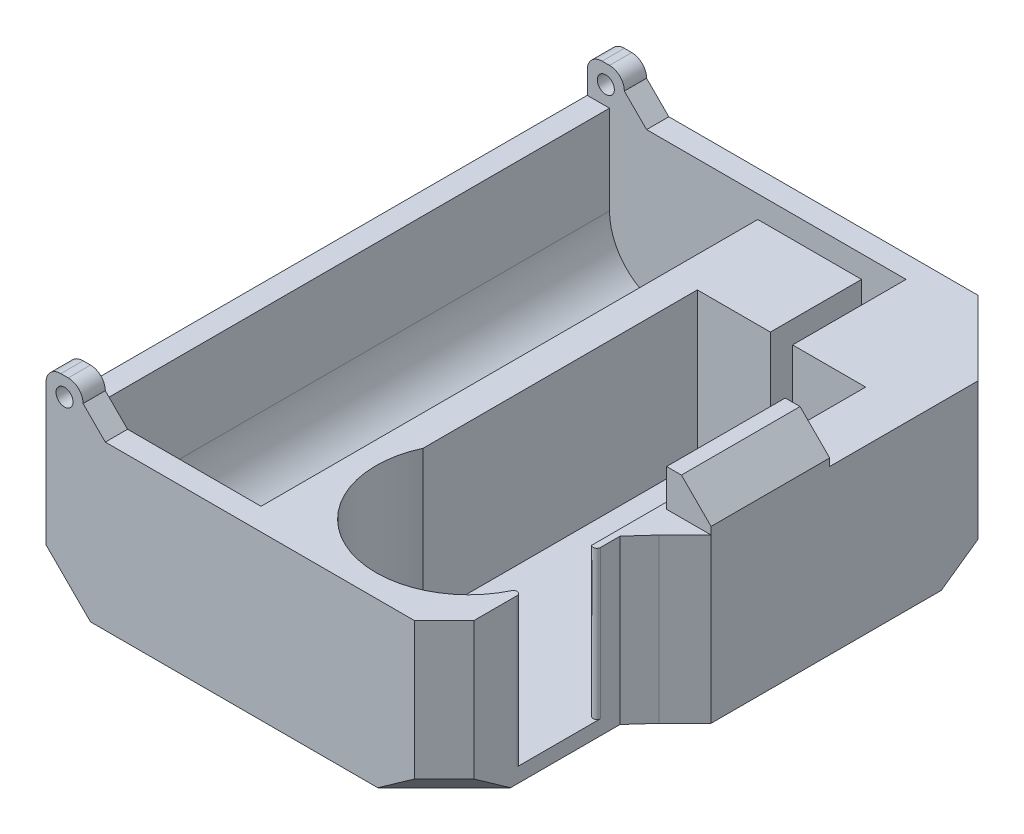
from build123d import *

# Parameters (mm, degrees)
BOSS_EXTRUDE1_START       = 10
SKETCH1_R                 = 1.15
BOSS_EXTRUDE1_DEPTH       = 76
SKETCH2_W                 = 6
SKETCH2_H                 = 16.4
CUT_EXTRUDE1_DEPTH        = 76
BOSS_EXTRUDE2_START       = -47.8
BOSS_EXTRUDE2_DEPTH       = 37.686187853
BOSS_EXTRUDE2_START_2     = -51.8
BOSS_EXTRUDE2_2_OUTLINE_W = 9.85
BOSS_EXTRUDE2_2_OUTLINE_H = 20
BOSS_EXTRUDE2_2_DEPTH     = 12.300000091
BOSS_EXTRUDE2_START_3     = -57.8
BOSS_EXTRUDE2_3_OUTLINE_R = 1.15
BOSS_EXTRUDE2_3_DEPTH     = 3
BOSS_EXTRUDE2_START_4     = 15.2
BOSS_EXTRUDE2_4_OUTLINE_R = 1.15
BOSS_EXTRUDE2_4_DEPTH     = 3
BOSS_EXTRUDE2_START_5     = -27.8
BOSS_EXTRUDE2_5_OUTLINE_W = 6
BOSS_EXTRUDE2_5_OUTLINE_H = 5
BOSS_EXTRUDE2_5_DEPTH     = 16
BOSS_EXTRUDE2_START_6     = -11.8
BOSS_EXTRUDE2_6_DEPTH     = 1.69328026
BOSS_EXTRUDE2_START_7     = -2
BOSS_EXTRUDE2_7_OUTLINE_W = 3
BOSS_EXTRUDE2_7_OUTLINE_H = 10
BOSS_EXTRUDE2_7_DEPTH     = 22
BOSS_EXTRUDE2_8_DEPTH     = 2
BOSS_EXTRUDE2_START_8     = -39.951533137
BOSS_EXTRUDE2_9_OUTLINE_W = 10
BOSS_EXTRUDE2_9_OUTLINE_H = 25.30671974
BOSS_EXTRUDE2_9_DEPTH     = 14.849242405
CHAMFER1_SIZE             = 10
CHAMFER2_SIZE             = 4
CHAMFER3_SIZE             = 4
SKETCH4_W                 = 5
SKETCH4_H                 = 3.2
CUT_EXTRUDE2_DEPTH        = 17
SKETCH5_W                 = 92.220715814
SKETCH5_H                 = 108.753281114
CUT_EXTRUDE3_DEPTH        = 17
BOSS_EXTRUDE3_DEPTH       = 3
BOSS_EXTRUDE4_DEPTH       = 3
CUT_EXTRUDE5_DEPTH        = 26
FILLET1_R                 = 0.5
FILLET2_R                 = 8
CHAMFER4_SIZE             = 6
CHAMFER6_SIZE             = 3.5
BOSS_EXTRUDE6_DEPTH       = 20
CUT_EXTRUDE10_DEPTH       = 34
SKETCH14_W                = 6.88450438
SKETCH14_H                = 12.178080633
CUT_EXTRUDE11_DEPTH       = 5
FILLET3_R                 = 0.5


with BuildPart() as part:
    # Sketch1 → Boss-Extrude1 (new body)
    with BuildSketch(Plane(origin=(0, 0, -57.8), x_dir=(-1, 0, 0), z_dir=(0, 0, -1)).offset(BOSS_EXTRUDE1_START)):
        with BuildLine():
            Line((39, 25), (-18.2, 25))
            Line((-18.2, 25), (-18.2, 20))
            Line((-18.2, 20), (39, 20))
            ThreePointArc((39, 20), (41.5, 22.5), (39, 25))
        make_face()
        with Locations((39, 22.5)):
            Circle(SKETCH1_R, mode=Mode.SUBTRACT)
    extrude(amount=BOSS_EXTRUDE1_DEPTH)

    # Sketch2 → Cut-Extrude1 (cut)
    with BuildSketch(Plane(origin=(0, 25, 0), x_dir=(1, 0, 0), z_dir=(0, 1, 0))):
        with Locations((15.2, 105.8)):
            Rectangle(SKETCH2_W, SKETCH2_H)
    extrude(amount=-CUT_EXTRUDE1_DEPTH, mode=Mode.SUBTRACT)

    # Chamfer1
    chamfer1_edges = [part.edges().sort_by_distance(p)[0] for p in [
        (18.2, 22.5, -143.8),
        (18.2, 22.5, -67.8),
    ]]
    chamfer(chamfer1_edges, length=CHAMFER1_SIZE)

    # Chamfer2
    chamfer2_edges = [part.edges().sort_by_distance(p)[0] for p in [
        (18.2, 25, -87.7),
        (18.2, 25, -123.9),
    ]]
    chamfer(chamfer2_edges, length=CHAMFER2_SIZE)

    # Sketch4 → Cut-Extrude2 (cut)
    with BuildSketch(Plane(origin=(0, 25, 0), x_dir=(1, 0, 0), z_dir=(0, 1, 0))):
        with Locations((-39, 69.4)):
            Rectangle(SKETCH4_W, SKETCH4_H)
        with Locations((-39, 142.2)):
            Rectangle(SKETCH4_W, SKETCH4_H)
    extrude(amount=-CUT_EXTRUDE2_DEPTH, mode=Mode.SUBTRACT)

    # Sketch5 → Cut-Extrude3 (cut)
    with BuildSketch(Plane(origin=(0, 25, 0), x_dir=(1, 0, 0), z_dir=(0, 1, 0))):
        with Locations((-7.000216009, 117.176640557)):
            Rectangle(SKETCH5_W, SKETCH5_H)
    extrude(amount=-CUT_EXTRUDE3_DEPTH, mode=Mode.SUBTRACT)


with BuildPart() as body_2:
    # Boss-Extrude2: read off the stored shape, not the designer's step
    # Boss-Extrude2 outline → Boss-Extrude2 (new body)
    with BuildSketch(Plane.XY.offset(BOSS_EXTRUDE2_START)):
        Polygon((18.2, -2), (18.2, 20), (11.34684114, 20), (11.34684114, 0), (-11.35315886, 0), (-11.35315886, 20), (-15.5, 20), (-20, 15.5), (-20, 0), (-38.5, 0), (-38.5, 20), (-41.5, 20), (-41.5, -2), align=None)
    extrude(amount=BOSS_EXTRUDE2_DEPTH)

    # Boss-Extrude2 2 outline → Boss-Extrude2 2 (add)
    with BuildSketch(Plane.XY.offset(BOSS_EXTRUDE2_START_2)):
        with Locations((6.42184114, 10)):
            Rectangle(BOSS_EXTRUDE2_2_OUTLINE_W, BOSS_EXTRUDE2_2_OUTLINE_H)
        Polygon((-1.50315886, 0), (-1.50315886, 20), (-15.5, 20), (-20, 15.5), (-20, 0), align=None)
    extrude(amount=BOSS_EXTRUDE2_2_DEPTH)

    # Boss-Extrude2 5 outline → Boss-Extrude2 5 (add)
    with BuildSketch(Plane.XY.offset(BOSS_EXTRUDE2_START_5)):
        with Locations((15.2, 22.5)):
            Rectangle(BOSS_EXTRUDE2_5_OUTLINE_W, BOSS_EXTRUDE2_5_OUTLINE_H)
    extrude(amount=BOSS_EXTRUDE2_5_DEPTH)

    # Boss-Extrude2 6 outline → Boss-Extrude2 6 (add)
    with BuildSketch(Plane.XY.offset(BOSS_EXTRUDE2_START_6)):
        Polygon((-11.35315886, 0), (-11.35315886, 20), (-15.5, 20), (-20, 15.5), (-20, 0), align=None)
    extrude(amount=BOSS_EXTRUDE2_6_DEPTH)



with BuildPart() as body_3:
    # Boss-Extrude2 3 outline → Boss-Extrude2 3 (new body)
    with BuildSketch(Plane.XY.offset(BOSS_EXTRUDE2_START_3)):
        with BuildLine():
            Line((1.49684114, 0), (1.49684114, 20))
            Line((1.49684114, 20), (-36.5, 20))
            Line((-36.5, 20), (-36.5, 23))
            ThreePointArc((-36.5, 23), (-37.085786438, 24.414213562), (-38.5, 25))
            Line((-38.5, 25), (-39.5, 25))
            ThreePointArc((-39.5, 25), (-40.914213562, 24.414213562), (-41.5, 23))
            Line((-41.5, 23), (-41.5, 20))
            Line((-41.5, 20), (-38.5, 20))
            Line((-38.5, 20), (-38.5, 0))
            Line((-38.5, 0), (1.49684114, 0))
        make_face()
        with Locations((-39, 22.5)):
            Circle(BOSS_EXTRUDE2_3_OUTLINE_R, mode=Mode.SUBTRACT)
    extrude(amount=BOSS_EXTRUDE2_3_DEPTH)


with BuildPart() as body_4:
    # Boss-Extrude2 4 outline → Boss-Extrude2 4 (new body)
    with BuildSketch(Plane.XY.offset(BOSS_EXTRUDE2_START_4)):
        with BuildLine():
            Line((1.49684114, 0), (1.49684114, 20))
            Line((1.49684114, 20), (-36.5, 20))
            Line((-36.5, 20), (-36.5, 23))
            ThreePointArc((-36.5, 23), (-37.085786438, 24.414213562), (-38.5, 25))
            Line((-38.5, 25), (-39.5, 25))
            ThreePointArc((-39.5, 25), (-40.914213562, 24.414213562), (-41.5, 23))
            Line((-41.5, 23), (-41.5, 20))
            Line((-41.5, 20), (-38.5, 20))
            Line((-38.5, 20), (-38.5, 0))
            Line((-38.5, 0), (1.49684114, 0))
        make_face()
        with Locations((-39, 22.5)):
            Circle(BOSS_EXTRUDE2_4_OUTLINE_R, mode=Mode.SUBTRACT)
    extrude(amount=BOSS_EXTRUDE2_4_DEPTH)


with BuildPart() as body_2_1:
    add(body_2.part)

    add(body_3.part)  # Boss-Extrude2 7 merges body 3

    add(body_4.part)  # Boss-Extrude2 7 merges body 4
    # Boss-Extrude2 7 outline → Boss-Extrude2 7 (add)
    with BuildSketch(Plane(origin=(0, 0, 0), x_dir=(1, 0, 0), z_dir=(0, 1, 0)).offset(BOSS_EXTRUDE2_START_7)):
        Polygon((18.2, 47.8), (8.2, 57.8), (1.49684114, 57.8), (1.49684114, 47.8), align=None)
        with BuildLine():
            Line((18.2, -8.2), (18.2, 10.113812147))
            Line((18.2, 10.113812147), (11.34684114, 10.113812147))
            ThreePointArc((11.34684114, 10.113812147), (0.0047491, -15.199999258), (-11.35315886, 10.10671974))
            Line((-11.35315886, 10.10671974), (-20, 10.10671974))
            Line((-20, 10.10671974), (-20, -15.2))
            Line((-20, -15.2), (-38.5, -15.2))
            Line((-38.5, -15.2), (-38.5, 10.113812147))
            Line((-38.5, 10.113812147), (-41.5, 10.113812147))
            Line((-41.5, 10.113812147), (-41.5, -18.2))
            Line((-41.5, -18.2), (8.2, -18.2))
            Line((8.2, -18.2), (18.2, -8.2))
        make_face()
        with Locations((-40, 52.8)):
            Rectangle(BOSS_EXTRUDE2_7_OUTLINE_W, BOSS_EXTRUDE2_7_OUTLINE_H)
    extrude(amount=BOSS_EXTRUDE2_7_DEPTH)

    # Boss-Extrude2 8 outline → Boss-Extrude2 8 (add)
    with BuildSketch(Plane(origin=(0, 0, 0), x_dir=(1, 0, 0), z_dir=(0, 1, 0)).offset(BOSS_EXTRUDE2_START_7)):
        Polygon((1.49684114, 47.8), (1.49684114, 57.8), (-38.5, 57.8), (-38.5, 47.8), (-20, 47.8), align=None)
        with BuildLine():
            Line((11.34684114, 10.113812147), (-38.5, 10.113812147))
            Line((-38.5, 10.113812147), (-38.5, -15.2))
            Line((-38.5, -15.2), (-20, -15.2))
            Line((-20, -15.2), (-20, 10.10671974))
            Line((-20, 10.10671974), (-11.35315886, 10.10671974))
            ThreePointArc((-11.35315886, 10.10671974), (0.0047491, -15.199999258), (11.34684114, 10.113812147))
        make_face()
    extrude(amount=BOSS_EXTRUDE2_8_DEPTH)

    # Boss-Extrude2 9 outline → Boss-Extrude2 9 (cut)
    with BuildSketch(Plane(origin=(0, 0, 0), x_dir=(0.7071067811865474, 0.7071067811865477, 0), z_dir=(0.7071067811865476, -0.7071067811865476, 0)).offset(BOSS_EXTRUDE2_START_8)):
        with Locations((0, 2.54664013)):
            Rectangle(BOSS_EXTRUDE2_9_OUTLINE_W, BOSS_EXTRUDE2_9_OUTLINE_H)
    extrude(amount=BOSS_EXTRUDE2_9_DEPTH, mode=Mode.SUBTRACT)

    # Chamfer3
    chamfer3_edges = [body_2_1.edges().sort_by_distance(p)[0] for p in [
        (18.2, 25, -19.8),
    ]]
    chamfer(chamfer3_edges, length=CHAMFER3_SIZE)

    # Sketch6 → Boss-Extrude3 (add)
    with BuildSketch(Plane.XY.offset(18.2)):
        Polygon((-36.5, 23), (-33.5, 20), (-37.431383681, 19.25446979), align=None)
    extrude(amount=-BOSS_EXTRUDE3_DEPTH)

    # Sketch7 → Boss-Extrude4 (add)
    with BuildSketch(Plane(origin=(0, 0, -57.8), x_dir=(-1, 0, 0), z_dir=(0, 0, -1))):
        Polygon((36.5, 23), (33.5, 20), (37.220279648, 19.344567212), align=None)
    extrude(amount=-BOSS_EXTRUDE4_DEPTH)

    # Sketch8 → Cut-Extrude5 (cut)
    with BuildSketch(Plane(origin=(0, 20, 0), x_dir=(1, 0, 0), z_dir=(0, 1, 0))):
        Polygon((18.2, 11.8), (14.7, 8.3), (14.7, -21.501109559), (24.075722879, -13.334137275), (24.580871836, 10.828821177), align=None)
    extrude(amount=-CUT_EXTRUDE5_DEPTH, mode=Mode.SUBTRACT)

    # Fillet1
    fillet1_edges = [body_2_1.edges().sort_by_distance(p)[0] for p in [
        (14.7, 10, -3.866522986),
        (14.7, 10, 3.866522986),
    ]]
    fillet(fillet1_edges, radius=FILLET1_R)

    # Fillet2
    fillet2_edges = [body_2_1.edges().sort_by_distance(p)[0] for p in [
        (-38.5, 0, -19.8),
    ]]
    fillet(fillet2_edges, radius=FILLET2_R)

    # Chamfer4
    chamfer4_edges = [body_2_1.edges().sort_by_distance(p)[0] for p in [
        (-41.5, -2, -19.8),
    ]]
    chamfer(chamfer4_edges, length=CHAMFER4_SIZE)

    # Chamfer6
    chamfer6_edges = [body_2_1.edges().sort_by_distance(p)[0] for p in [
        (13.2, -2, -52.8),
        (11.45, -2, 14.95),
    ]]
    chamfer(chamfer6_edges, length=CHAMFER6_SIZE)

    # Sketch12 → Boss-Extrude6 (add)
    with BuildSketch(Plane(origin=(0, 0, 0), x_dir=(1, 0, 0), z_dir=(0, 1, 0))):
        with BuildLine():
            Line((0, -16.836473334), (-10.35781432, -16.574633061))
            Line((-10.35781432, -16.574633061), (-15.5, -4.91441497))
            Line((-15.5, -4.91441497), (-15.5, 9.8))
            Line((-15.5, 9.8), (-11.35315886, 10.10671974))
            Line((-11.35315886, 10.10671974), (-11.35315886, 2.5302757))
            ThreePointArc((-11.35315886, 2.5302757), (0.007539589, -15.199997726), (11.34684114, 2.543967596))
            Line((11.34684114, 2.543967596), (11.34684114, 10.113812147))
            Line((11.34684114, 10.113812147), (14.7, 8.3))
            Line((14.7, 8.3), (14.7, -11.7))
            Line((14.7, -11.7), (4.492447971, -17.057179979))
            Line((4.492447971, -17.057179979), (0, -16.836473334))
        make_face()
    extrude(amount=BOSS_EXTRUDE6_DEPTH)

    # Sketch13 → Cut-Extrude10 (cut)
    with BuildSketch(Plane(origin=(0, 20, 0), x_dir=(1, 0, 0), z_dir=(0, 1, 0))):
        Polygon((14.7, 8.3), (12.2, 5.521362845), (12.2, -21.090159973), (18.418004591, -14.179128538), align=None)
    extrude(amount=-CUT_EXTRUDE10_DEPTH, mode=Mode.SUBTRACT)

    # Sketch14 → Cut-Extrude11 (cut)
    with BuildSketch(Plane(origin=(6.069669914, -8.583809512, 6.069669914), x_dir=(0.8660254037844393, 0.40824829046386313, -0.28867513459481114), z_dir=(0.49999999999999906, -0.7071067811865493, 0.49999999999999833))):
        with Locations((7.600391897, 9.638669458)):
            Rectangle(SKETCH14_W, SKETCH14_H)
    extrude(amount=CUT_EXTRUDE11_DEPTH, mode=Mode.SUBTRACT)

    # Fillet3
    # the kernel refuses this fillet: 0.5 mm, written as the material it takes off along each edge
    with BuildSketch(Plane(origin=(12.2, 27.361092772, 5.422131518), x_dir=(0, 0, 1), z_dir=(0, -1, 0))) as fillet3_piece_1:
        with BuildLine():
            CenterArc((2.944437109, 0.5), FILLET3_R, 115.841932763, 154.158067237)
            ThreePointArc((2.726492162, 0.95), (1.39076711, 0.396014873), (0, 0))
            Line((0, 0), (2.944437109, 0))
        make_face()
    extrude(amount=27.361092772, mode=Mode.SUBTRACT)
    with BuildSketch(Plane(origin=(12.2, 27.189458898, -0.022131518), x_dir=(0, 0, -1), z_dir=(0, -1, 0))) as fillet3_piece_2:
        with BuildLine():
            CenterArc((2.875783559, -0.5), FILLET3_R, 90, 134.936099196)
            ThreePointArc((2.521836078, -0.85315886), (1.28369596, -0.359250606), (0, 0))
            Line((0, 0), (2.875783559, 0))
        make_face()
    extrude(amount=27.189458898, mode=Mode.SUBTRACT)


solid = body_2_1.part
